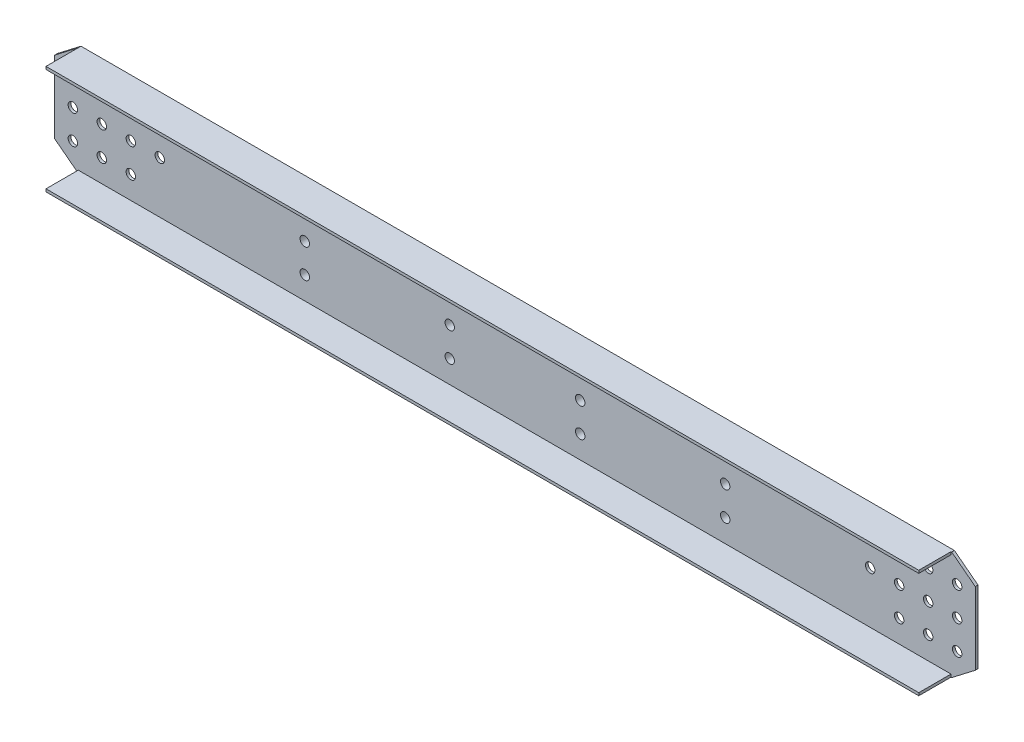
from build123d import *

# Parameters (mm, degrees)
SKETCH_1_R          = 13
EXTRUDE_689_DEPTH   = 7.5
SKETCH_2_W          = 2408.049034164
SKETCH_2_H          = 7.5
EXTRUDE_1_DEPTH     = 89
SKETCH_3_W          = 80
SKETCH_3_H          = 240
EXTRUDE_2_DEPTH     = 16
SKETCH_4_R          = 13
CUT_EXTRUDE_1_DEPTH = 1308.983562588


with BuildPart() as part:
    # 草图1 → Extrude 689 (new body)
    with BuildSketch(Plane.XY):
        Polygon((-1205, 0), (1205, 0), (1270, 50), (1270, 250), (1205, 300), (-1205, 300), (-1270, 250), (-1270, 50), align=None)
        with Locations((-1220, 230)):
            Circle(SKETCH_1_R, mode=Mode.SUBTRACT)
        with Locations((-1220, 150)):
            Circle(SKETCH_1_R, mode=Mode.SUBTRACT)
        with Locations((-1140, 230)):
            Circle(SKETCH_1_R, mode=Mode.SUBTRACT)
        with Locations((-1140, 150)):
            Circle(SKETCH_1_R, mode=Mode.SUBTRACT)
        with Locations((-1060, 230)):
            Circle(SKETCH_1_R, mode=Mode.SUBTRACT)
        with Locations((-1060, 150)):
            Circle(SKETCH_1_R, mode=Mode.SUBTRACT)
        with Locations((-980, 150)):
            Circle(SKETCH_1_R, mode=Mode.SUBTRACT)
        with Locations((-1060, 70)):
            Circle(SKETCH_1_R, mode=Mode.SUBTRACT)
        with Locations((-1140, 70)):
            Circle(SKETCH_1_R, mode=Mode.SUBTRACT)
        with Locations((-1220, 70)):
            Circle(SKETCH_1_R, mode=Mode.SUBTRACT)
        with Locations((1220, 70)):
            Circle(SKETCH_1_R, mode=Mode.SUBTRACT)
        with Locations((1140, 70)):
            Circle(SKETCH_1_R, mode=Mode.SUBTRACT)
        with Locations((1060, 70)):
            Circle(SKETCH_1_R, mode=Mode.SUBTRACT)
        with Locations((980, 150)):
            Circle(SKETCH_1_R, mode=Mode.SUBTRACT)
        with Locations((1060, 150)):
            Circle(SKETCH_1_R, mode=Mode.SUBTRACT)
        with Locations((1060, 230)):
            Circle(SKETCH_1_R, mode=Mode.SUBTRACT)
        with Locations((1140, 150)):
            Circle(SKETCH_1_R, mode=Mode.SUBTRACT)
        with Locations((1140, 230)):
            Circle(SKETCH_1_R, mode=Mode.SUBTRACT)
        with Locations((1220, 150)):
            Circle(SKETCH_1_R, mode=Mode.SUBTRACT)
        with Locations((1220, 230)):
            Circle(SKETCH_1_R, mode=Mode.SUBTRACT)
    extrude(amount=-EXTRUDE_689_DEPTH)

    # 草图2 → 凸台-拉伸1 (add)
    with BuildSketch(Plane.XY):
        with Locations((-0.975482918, 296.25)):
            Rectangle(SKETCH_2_W, SKETCH_2_H)
        with Locations((-0.975482918, 3.75)):
            Rectangle(SKETCH_2_W, SKETCH_2_H)
    extrude(amount=EXTRUDE_1_DEPTH)

    # 草图3 → 凸台-拉伸2 (add)
    with BuildSketch(Plane(origin=(0, 0, -7.5), x_dir=(-1, 0, 0), z_dir=(0, 0, -1))):
        with Locations((-580, 150)):
            Rectangle(SKETCH_3_W, SKETCH_3_H)
        with Locations((-180, 150)):
            Rectangle(SKETCH_3_W, SKETCH_3_H)
        with Locations((180, 150)):
            Rectangle(SKETCH_3_W, SKETCH_3_H)
        with Locations((580, 150)):
            Rectangle(SKETCH_3_W, SKETCH_3_H)
    extrude(amount=EXTRUDE_2_DEPTH)

    # 草图4 → 切除-拉伸1 (cut, through all)
    with BuildSketch(Plane.XY):
        with Locations((-580, 230)):
            Circle(SKETCH_4_R)
        with Locations((-580, 150)):
            Circle(SKETCH_4_R)
        with Locations((-180, 230)):
            Circle(SKETCH_4_R)
        with Locations((-180, 150)):
            Circle(SKETCH_4_R)
        with Locations((-180, 70)):
            Circle(SKETCH_4_R)
        with Locations((-580, 70)):
            Circle(SKETCH_4_R)
        with Locations((580, 70)):
            Circle(SKETCH_4_R)
        with Locations((180, 70)):
            Circle(SKETCH_4_R)
        with Locations((180, 150)):
            Circle(SKETCH_4_R)
        with Locations((180, 230)):
            Circle(SKETCH_4_R)
        with Locations((580, 150)):
            Circle(SKETCH_4_R)
        with Locations((580, 230)):
            Circle(SKETCH_4_R)
    extrude(amount=-CUT_EXTRUDE_1_DEPTH, mode=Mode.SUBTRACT)


solid = part.part
